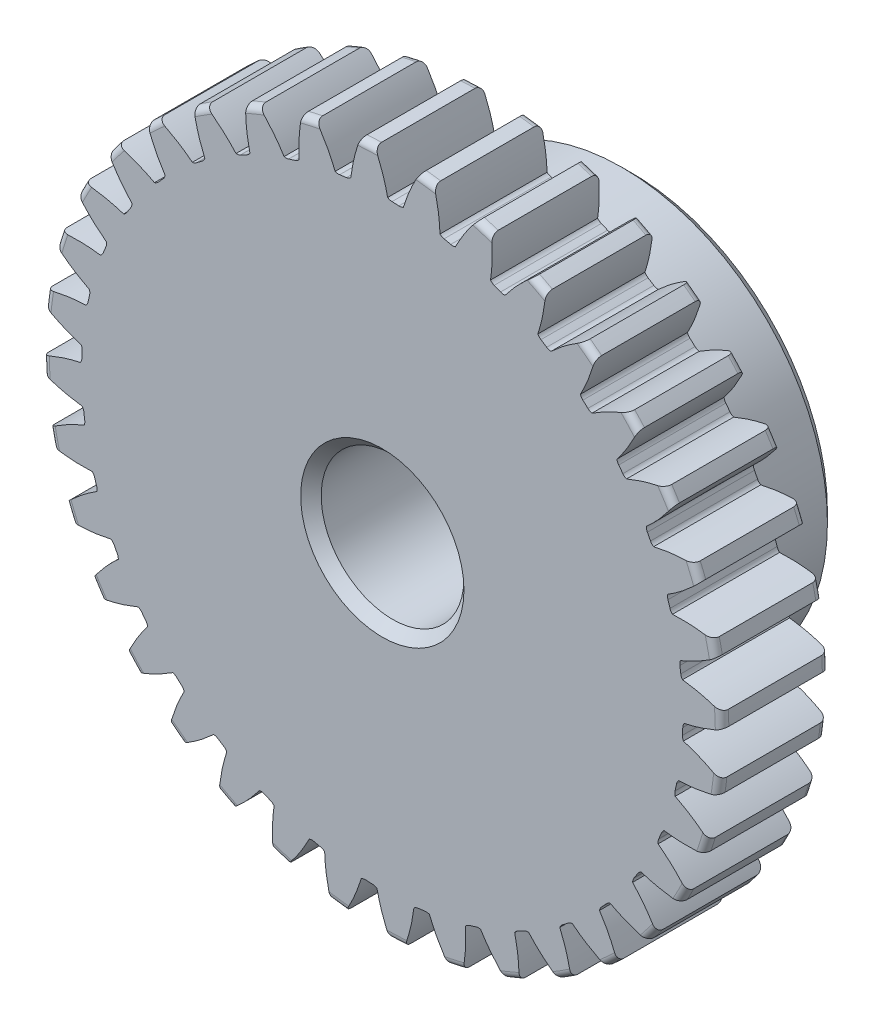
from build123d import *

# Parameters (mm, degrees)
SKETCH1_R           = 15.113
BOSS_EXTRUDE1_DEPTH = 4.7625
SKETCH2_W           = 6.3627
SKETCH2_H           = 9.128125
FILLET2_R           = 0.30226
CUT_EXTRUDE1_DEPTH  = 25.095136772
FILLET1_R           = 0.37404675
CIRPATTERN1_START   = -4.7625
CIRPATTERN1_DEPTH   = 4.7625
SKETCH5_R           = 3.175
CUT_EXTRUDE2_DEPTH  = 25.090372429
CHAMFER1_SIZE       = 0.45640625


# Read off the part's stored shape, not the designer's step: CirPattern1
with BuildPart() as part:
    # Sketch1 → Boss-Extrude1 (new body)
    with BuildSketch(Plane.XY):
        Circle(SKETCH1_R)
    extrude(amount=-BOSS_EXTRUDE1_DEPTH)

    # Sketch2 → Revolve1 (revolve)
    with BuildSketch(Plane(origin=(0, 0, 0), x_dir=(0, 0, -1), z_dir=(1, 0, 0)), mode=Mode.PRIVATE) as revolve1_sk:
        with Locations((7.94385, 4.5640625)):
            Rectangle(SKETCH2_W, SKETCH2_H)
    revolve(revolve1_sk.sketch.rotate(Axis((0, 0, -4.7625), (0, 0, -1)), 90), axis=Axis((0, 0, -4.7625), (0, 0, -1)))

    # Fillet2
    fillet2_edges = [part.edges().sort_by_distance(p)[0] for p in [
        (-15.113, 0, 0),
        (-15.113, 0, -4.7625),
        (-9.128125, 0, -4.7625),
    ]]
    fillet(fillet2_edges, radius=FILLET2_R)

    # Sketch4 → Cut-Extrude1 (cut, through all)
    with BuildSketch(Plane.XY):
        with BuildLine():
            Line((0.237176436, 13.423763219), (0.237176436, 13.367027258))
            ThreePointArc((0.237176436, 13.367027258), (0.583154678, 13.35640674), (0.928742002, 13.336832783))
            Line((0.928742002, 13.336832783), (0.933686879, 13.393352845))
            add(Edge.make_bspline(
                [(5.384958135, 18.216495788), (1.903470706, 16.574475468), (0.933686879, 13.393352845)],
                knots=[0, 0, 0, 1, 1, 1], degree=2))
            ThreePointArc((5.384958135, 18.216495788), (0.828584885, 18.977669509), (-3.776790724, 18.616507319))
            add(Edge.make_bspline(
                [(-3.776790724, 18.616507319), (-0.451663302, 16.67730308), (0.237176436, 13.423763219)],
                knots=[0, 0, 0, 1, 1, 1], degree=2))
        make_face()
    extrude(amount=-CUT_EXTRUDE1_DEPTH, mode=Mode.SUBTRACT)

    # Fillet1
    # the kernel refuses this fillet: 0.37404675 mm, written as the material it adds along each edge
    with BuildSketch(Plane(origin=(0.928742002, 13.336832783, 0), x_dir=(0.08715594602887619, 0.9961946803069225, 0), z_dir=(0, 0, -1))) as fillet1_piece_1:
        with BuildLine():
            CenterArc((0.369006284, -0.205908271), FILLET1_R, 146.599497408, 31.552947117)
            Line((-0.004846016, -0.193848877), (-0.012323062, -0.193607689))
            ThreePointArc((-0.012323062, -0.193607689), (-0.009550147, -0.096746268), (-0.007479758, 0.000132716))
            Line((-0.007479758, 0.000132716), (0, 0.007480935))
            ThreePointArc((0, 0.007480935), (0.02836798, 0.007480935), (0.050490554, 0.004118165))
            Line((0.050490554, 0.004118165), (0.056735961, 0))
        make_face()
    extrude(amount=4.7625)
    with BuildSketch(Plane(origin=(0.237176436, 13.367027258, 0), x_dir=(9.239634799397424e-12, 1.0, 0), z_dir=(0, 0, -1))) as fillet1_piece_2:
        with BuildLine():
            CenterArc((0.369006284, 0.205908271), FILLET1_R, 181.847555475, 31.552947117)
            Line((-0.004846016, 0.193848877), (-0.012323062, 0.193607689))
            ThreePointArc((-0.012323062, 0.193607689), (-0.009550147, 0.096746268), (-0.007479758, -0.000132716))
            Line((-0.007479758, -0.000132716), (0, -0.007480935))
            ThreePointArc((0, -0.007480935), (0.02836798, -0.007480935), (0.050490554, -0.004118165))
            Line((0.050490554, -0.004118165), (0.056735961, 0))
        make_face()
    extrude(amount=4.7625)

    # CirPattern1 outline → CirPattern1 (cut)
    with BuildSketch(Plane.XY.offset(CIRPATTERN1_START)):
        with BuildLine():
            ThreePointArc((-1.593973254, 13.273768103), (-1.4946809, 13.29988325), (-1.406229237, 13.352010745))
            add(Edge.make_bspline(
                [(-1.406229237, 13.352010745), (-1.295819924, 14.257210449), (-0.979335817, 15.08124007)],
                knots=[0, 0, 0, 0.274203611, 0.274203611, 0.274203611], degree=2))
            ThreePointArc((-0.979335817, 15.08124007), (-1.972640814, 14.983706391), (-2.957342519, 14.820826367))
            add(Edge.make_bspline(
                [(-2.957342519, 14.820826367), (-2.438368785, 14.106791157), (-2.097438827, 13.261011348)],
                knots=[0.725796389, 0.725796389, 0.725796389, 1, 1, 1], degree=2))
            ThreePointArc((-2.097438827, 13.261011348), (-1.998509498, 13.233553009), (-1.895841352, 13.234026445))
            ThreePointArc((-1.895841352, 13.234026445), (-1.745020443, 13.254756657), (-1.593973254, 13.273768103))
        make_face()
        with BuildLine():
            add(Edge.make_bspline(
                [(-3.70341779, 12.904974556), (-3.75187212, 13.815594618), (-3.58328736, 14.682062266)],
                knots=[0, 0, 0, 0.274203611, 0.274203611, 0.274203611], degree=2))
            ThreePointArc((-3.58328736, 14.682062266), (-4.544565277, 14.413524739), (-5.486023331, 14.082127573))
            add(Edge.make_bspline(
                [(-5.486023331, 14.082127573), (-4.850943061, 13.469059005), (-4.368324473, 12.695330359)],
                knots=[0.725796389, 0.725796389, 0.725796389, 1, 1, 1], degree=2))
            ThreePointArc((-4.368324473, 12.695330359), (-4.266130012, 12.68546807), (-4.165103837, 12.703762451))
            ThreePointArc((-4.165103837, 12.703762451), (-4.020174, 12.7503675), (-3.874722861, 12.795319188))
            ThreePointArc((-3.874722861, 12.795319188), (-3.781473829, 12.838279524), (-3.70341779, 12.904974556))
        make_face()
        with BuildLine():
            ThreePointArc((4.237812028, 14.506678401), (3.271053391, 14.754761222), (2.290028217, 14.938491884))
            add(Edge.make_bspline(
                [(2.290028217, 14.938491884), (2.533489579, 14.090018794), (2.564585214, 13.178640836)],
                knots=[0.725796389, 0.725796389, 0.725796389, 1, 1, 1], degree=2))
            ThreePointArc((2.564585214, 13.178640836), (2.648157068, 13.119002614), (2.744795493, 13.084332925))
            ThreePointArc((2.744795493, 13.084332925), (2.893610938, 13.052229163), (3.042051164, 13.018432897))
            ThreePointArc((3.042051164, 13.018432897), (3.144287363, 13.009013123), (3.245233391, 13.027744695))
            add(Edge.make_bspline(
                [(3.245233391, 13.027744695), (3.658580741, 13.840591968), (4.237812028, 14.506678401)],
                knots=[0, 0, 0, 0.274203611, 0.274203611, 0.274203611], degree=2))
        make_face()
        with BuildLine():
            add(Edge.make_bspline(
                [(-5.888079866, 12.065827245), (-6.093925581, 12.954198936), (-6.078362531, 13.836777429)],
                knots=[0, 0, 0, 0.274203611, 0.274203611, 0.274203611], degree=2))
            ThreePointArc((-6.078362531, 13.836777429), (-6.978405423, 13.405395432), (-7.8480141, 12.915550458))
            add(Edge.make_bspline(
                [(-7.8480141, 12.915550458), (-7.116123887, 12.422076311), (-6.50648079, 11.74390818)],
                knots=[0.725796389, 0.725796389, 0.725796389, 1, 1, 1], degree=2))
            ThreePointArc((-6.50648079, 11.74390818), (-6.404126325, 11.751941604), (-6.30781175, 11.787501063))
            ThreePointArc((-6.30781175, 11.787501063), (-6.173176605, 11.858564879), (-6.037740974, 11.928090975))
            ThreePointArc((-6.037740974, 11.928090975), (-5.953368588, 11.986591171), (-5.888079866, 12.065827245))
        make_face()
        with BuildLine():
            ThreePointArc((6.69248841, 13.550401024), (5.783496138, 13.962590786), (4.849279435, 14.3138834))
            add(Edge.make_bspline(
                [(4.849279435, 14.3138834), (4.941706267, 13.4360239), (4.814070367, 12.533092121)],
                knots=[0.725796389, 0.725796389, 0.725796389, 1, 1, 1], degree=2))
            ThreePointArc((4.814070367, 12.533092121), (4.886016509, 12.459847837), (4.97516645, 12.408923772))
            ThreePointArc((4.97516645, 12.408923772), (5.116146294, 12.351466207), (5.25646272, 12.292407008))
            ThreePointArc((5.25646272, 12.292407008), (5.355509995, 12.265377212), (5.45817513, 12.266295116))
            add(Edge.make_bspline(
                [(5.45817513, 12.266295116), (6.006392252, 12.995016398), (6.69248841, 13.550401024)],
                knots=[0, 0, 0, 0.274203611, 0.274203611, 0.274203611], degree=2))
        make_face()
        with BuildLine():
            add(Edge.make_bspline(
                [(-7.893835616, 10.860065878), (-8.250818197, 11.699196474), (-8.388749731, 12.571069112)],
                knots=[0, 0, 0, 0.274203611, 0.274203611, 0.274203611], degree=2))
            ThreePointArc((-8.388749731, 12.571069112), (-9.200210252, 11.989949969), (-9.971546931, 11.356540879))
            add(Edge.make_bspline(
                [(-9.971546931, 11.356540879), (-9.16508489, 10.997655115), (-8.446940981, 10.435653294)],
                knots=[0.725796389, 0.725796389, 0.725796389, 1, 1, 1], degree=2))
            ThreePointArc((-8.446940981, 10.435653294), (-8.347536499, 10.461338338), (-8.258859995, 10.51308242))
            ThreePointArc((-8.258859995, 10.51308242), (-8.138610362, 10.606445764), (-8.017305382, 10.698433754))
            ThreePointArc((-8.017305382, 10.698433754), (-7.944373255, 10.770696311), (-7.893835616, 10.860065878))
        make_face()
        with BuildLine():
            ThreePointArc((8.943816918, 12.182401569), (8.120210282, 12.746174093), (7.261187752, 13.254354811))
            add(Edge.make_bspline(
                [(7.261187752, 13.254354811), (7.19977171, 12.373782219), (6.917282428, 11.506731744)],
                knots=[0.725796389, 0.725796389, 0.725796389, 1, 1, 1], degree=2))
            ThreePointArc((6.917282428, 11.506731744), (6.97541681, 11.422106888), (7.054369492, 11.356475749))
            ThreePointArc((7.054369492, 11.356475749), (7.183230135, 11.275410201), (7.311159316, 11.192882552))
            ThreePointArc((7.311159316, 11.192882552), (7.404008166, 11.149064021), (7.505272979, 11.132140366))
            add(Edge.make_bspline(
                [(7.505272979, 11.132140366), (8.171702574, 11.75459383), (8.943816918, 12.182401569)],
                knots=[0, 0, 0, 0.274203611, 0.274203611, 0.274203611], degree=2))
        make_face()
        with BuildLine():
            add(Edge.make_bspline(
                [(-9.659741165, 9.324326906), (-10.157013877, 10.088719848), (-10.444249016, 10.923395222)],
                knots=[0, 0, 0, 0.274203611, 0.274203611, 0.274203611], degree=2))
            ThreePointArc((-10.444249016, 10.923395222), (-11.142471348, 10.210195943), (-11.792099355, 9.452468551))
            add(Edge.make_bspline(
                [(-11.792099355, 9.452468551), (-10.935569426, 9.239075733), (-10.130745145, 8.810316363)],
                knots=[0.725796389, 0.725796389, 0.725796389, 1, 1, 1], degree=2))
            ThreePointArc((-10.130745145, 8.810316363), (-10.037311002, 8.852872601), (-9.958966958, 8.919229087))
            ThreePointArc((-9.958966958, 8.919229087), (-9.856756562, 9.032055163), (-9.753268024, 9.143710036))
            ThreePointArc((-9.753268024, 9.143710036), (-9.693992161, 9.227539294), (-9.659741165, 9.324326906))
        make_face()
        with BuildLine():
            ThreePointArc((10.923392075, 10.444246007), (10.210195946, 11.142471351), (9.452468554, 11.792099359))
            add(Edge.make_bspline(
                [(9.452468554, 11.792099359), (9.239075733, 10.935569426), (8.810316363, 10.130745145)],
                knots=[0.725796389, 0.725796389, 0.725796389, 1, 1, 1], degree=2))
            ThreePointArc((8.810316363, 10.130745145), (8.852872601, 10.037311002), (8.919229087, 9.958966958))
            ThreePointArc((8.919229087, 9.958966958), (9.032055163, 9.856756562), (9.143710036, 9.753268024))
            ThreePointArc((9.143710036, 9.753268024), (9.227539294, 9.693992161), (9.324326906, 9.659741165))
            add(Edge.make_bspline(
                [(9.324326906, 9.659741165), (10.088719848, 10.157013877), (10.923392075, 10.444246007)],
                knots=[0, 0, 0, 0.274203611, 0.274203611, 0.274203611], degree=2))
        make_face()
        with BuildLine():
            add(Edge.make_bspline(
                [(-11.132140366, 7.505272979), (-11.75459383, 8.171702574), (-12.18240508, 8.943819495)],
                knots=[0, 0, 0, 0.274203611, 0.274203611, 0.274203611], degree=2))
            ThreePointArc((-12.18240508, 8.943819495), (-12.74617409, 8.12021028), (-13.254354808, 7.26118775))
            add(Edge.make_bspline(
                [(-13.254354808, 7.26118775), (-12.373782219, 7.19977171), (-11.506731744, 6.917282428)],
                knots=[0.725796389, 0.725796389, 0.725796389, 1, 1, 1], degree=2))
            ThreePointArc((-11.506731744, 6.917282428), (-11.422106888, 6.97541681), (-11.356475749, 7.054369492))
            ThreePointArc((-11.356475749, 7.054369492), (-11.275410201, 7.183230135), (-11.192882552, 7.311159316))
            ThreePointArc((-11.192882552, 7.311159316), (-11.149064021, 7.404008166), (-11.132140366, 7.505272979))
        make_face()
        with BuildLine():
            ThreePointArc((12.571065491, 8.388747314), (11.989949973, 9.200210255), (11.356540882, 9.971546934))
            add(Edge.make_bspline(
                [(11.356540882, 9.971546934), (10.997655115, 9.16508489), (10.435653294, 8.446940981)],
                knots=[0.725796389, 0.725796389, 0.725796389, 1, 1, 1], degree=2))
            ThreePointArc((10.435653294, 8.446940981), (10.461338338, 8.347536499), (10.51308242, 8.258859995))
            ThreePointArc((10.51308242, 8.258859995), (10.606445764, 8.138610362), (10.698433754, 8.017305382))
            ThreePointArc((10.698433754, 8.017305382), (10.770696311, 7.944373255), (10.860065878, 7.893835616))
            add(Edge.make_bspline(
                [(10.860065878, 7.893835616), (11.699196474, 8.250818197), (12.571065491, 8.388747314)],
                knots=[0, 0, 0, 0.274203611, 0.274203611, 0.274203611], degree=2))
        make_face()
        with BuildLine():
            add(Edge.make_bspline(
                [(-12.266295116, 5.45817513), (-12.995016398, 6.006392252), (-13.550404929, 6.692490339)],
                knots=[0, 0, 0, 0.274203611, 0.274203611, 0.274203611], degree=2))
            ThreePointArc((-13.550404929, 6.692490339), (-13.962590782, 5.783496137), (-14.313883396, 4.849279434))
            add(Edge.make_bspline(
                [(-14.313883396, 4.849279434), (-13.4360239, 4.941706267), (-12.533092121, 4.814070367)],
                knots=[0.725796389, 0.725796389, 0.725796389, 1, 1, 1], degree=2))
            ThreePointArc((-12.533092121, 4.814070367), (-12.459847837, 4.886016509), (-12.408923772, 4.97516645))
            ThreePointArc((-12.408923772, 4.97516645), (-12.351466207, 5.116146294), (-12.292407008, 5.25646272))
            ThreePointArc((-12.292407008, 5.25646272), (-12.265377212, 5.355509995), (-12.266295116, 5.45817513))
        make_face()
        with BuildLine():
            ThreePointArc((13.836773443, 6.07836078), (13.405395436, 6.978405425), (12.915550462, 7.848014102))
            add(Edge.make_bspline(
                [(12.915550462, 7.848014102), (12.422076311, 7.116123887), (11.74390818, 6.50648079)],
                knots=[0.725796389, 0.725796389, 0.725796389, 1, 1, 1], degree=2))
            ThreePointArc((11.74390818, 6.50648079), (11.751941604, 6.404126325), (11.787501063, 6.30781175))
            ThreePointArc((11.787501063, 6.30781175), (11.858564879, 6.173176605), (11.928090975, 6.037740974))
            ThreePointArc((11.928090975, 6.037740974), (11.986591171, 5.953368588), (12.065827245, 5.888079866))
            add(Edge.make_bspline(
                [(12.065827245, 5.888079866), (12.954198936, 6.093925581), (13.836773443, 6.07836078)],
                knots=[0, 0, 0, 0.274203611, 0.274203611, 0.274203611], degree=2))
        make_face()
        with BuildLine():
            add(Edge.make_bspline(
                [(-13.027744695, 3.245233391), (-13.840591968, 3.658580741), (-14.506682582, 4.23781325)],
                knots=[0, 0, 0, 0.274203611, 0.274203611, 0.274203611], degree=2))
            ThreePointArc((-14.506682582, 4.23781325), (-14.754761219, 3.27105339), (-14.938491881, 2.290028216))
            add(Edge.make_bspline(
                [(-14.938491881, 2.290028216), (-14.090018794, 2.533489579), (-13.178640836, 2.564585214)],
                knots=[0.725796389, 0.725796389, 0.725796389, 1, 1, 1], degree=2))
            ThreePointArc((-13.178640836, 2.564585214), (-13.119002614, 2.648157068), (-13.084332925, 2.744795493))
            ThreePointArc((-13.084332925, 2.744795493), (-13.052229163, 2.893610938), (-13.018432897, 3.042051164))
            ThreePointArc((-13.018432897, 3.042051164), (-13.009013123, 3.144287363), (-13.027744695, 3.245233391))
        make_face()
        with BuildLine():
            ThreePointArc((14.682058037, 3.583286328), (14.413524743, 4.544565278), (14.082127577, 5.486023332))
            add(Edge.make_bspline(
                [(14.082127577, 5.486023332), (13.469059005, 4.850943061), (12.695330359, 4.368324473)],
                knots=[0.725796389, 0.725796389, 0.725796389, 1, 1, 1], degree=2))
            ThreePointArc((12.695330359, 4.368324473), (12.68546807, 4.266130012), (12.703762451, 4.165103837))
            ThreePointArc((12.703762451, 4.165103837), (12.7503675, 4.020174), (12.795319188, 3.874722861))
            ThreePointArc((12.795319188, 3.874722861), (12.838279524, 3.781473829), (12.904974556, 3.70341779))
            add(Edge.make_bspline(
                [(12.904974556, 3.70341779), (13.815594618, 3.75187212), (14.682058037, 3.583286328)],
                knots=[0, 0, 0, 0.274203611, 0.274203611, 0.274203611], degree=2))
        make_face()
        with BuildLine():
            add(Edge.make_bspline(
                [(-13.393352845, 0.933686879), (-14.265628155, 1.199605106), (-15.022182026, 1.65437235)],
                knots=[0, 0, 0, 0.274203611, 0.274203611, 0.274203611], degree=2))
            ThreePointArc((-15.022182026, 1.65437235), (-15.098615702, 0.659221342), (-15.109201849, -0.33880435))
            add(Edge.make_bspline(
                [(-15.109201849, -0.33880435), (-14.315895597, 0.048294093), (-13.423763219, 0.237176436)],
                knots=[0.725796389, 0.725796389, 0.725796389, 1, 1, 1], degree=2))
            ThreePointArc((-13.423763219, 0.237176436), (-13.379543135, 0.329834715), (-13.362181243, 0.431025313))
            ThreePointArc((-13.362181243, 0.431025313), (-13.35640674, 0.583154677), (-13.34890029, 0.735208423))
            ThreePointArc((-13.34890029, 0.735208423), (-13.357376753, 0.837527151), (-13.393352845, 0.933686879))
        make_face()
        with BuildLine():
            ThreePointArc((15.081235726, 0.979335535), (14.983706395, 1.972640815), (14.820826371, 2.957342519))
            add(Edge.make_bspline(
                [(14.820826371, 2.957342519), (14.106791157, 2.438368785), (13.261011348, 2.097438827)],
                knots=[0.725796389, 0.725796389, 0.725796389, 1, 1, 1], degree=2))
            ThreePointArc((13.261011348, 2.097438827), (13.233553009, 1.998509498), (13.234026445, 1.895841352))
            ThreePointArc((13.234026445, 1.895841352), (13.254756657, 1.745020443), (13.273768103, 1.593973254))
            ThreePointArc((13.273768103, 1.593973254), (13.29988325, 1.4946809), (13.352010745, 1.406229237))
            add(Edge.make_bspline(
                [(13.352010745, 1.406229237), (14.257210449, 1.295819924), (15.081235726, 0.979335535)],
                knots=[0, 0, 0, 0.274203611, 0.274203611, 0.274203611], degree=2))
        make_face()
        with BuildLine():
            add(Edge.make_bspline(
                [(-13.352010745, -1.406229237), (-14.257210449, -1.295819924), (-15.08124007, -0.979335817)],
                knots=[0, 0, 0, 0.274203611, 0.274203611, 0.274203611], degree=2))
            ThreePointArc((-15.08124007, -0.979335817), (-14.983706388, -1.972640814), (-14.820826365, -2.957342518))
            add(Edge.make_bspline(
                [(-14.820826365, -2.957342518), (-14.106791157, -2.438368785), (-13.261011348, -2.097438827)],
                knots=[0.725796389, 0.725796389, 0.725796389, 1, 1, 1], degree=2))
            ThreePointArc((-13.261011348, -2.097438827), (-13.233553009, -1.998509498), (-13.234026445, -1.895841352))
            ThreePointArc((-13.234026445, -1.895841352), (-13.254756657, -1.745020443), (-13.273768103, -1.593973254))
            ThreePointArc((-13.273768103, -1.593973254), (-13.29988325, -1.4946809), (-13.352010745, -1.406229237))
        make_face()
        with BuildLine():
            ThreePointArc((15.022177699, -1.654371873), (15.098615709, -0.659221342), (15.109201856, 0.33880435))
            add(Edge.make_bspline(
                [(15.109201856, 0.33880435), (14.315895597, -0.048294093), (13.423763219, -0.237176436)],
                knots=[0.725796389, 0.725796389, 0.725796389, 1, 1, 1], degree=2))
            ThreePointArc((13.423763219, -0.237176436), (13.379543135, -0.329834715), (13.362181243, -0.431025313))
            ThreePointArc((13.362181243, -0.431025313), (13.35640674, -0.583154677), (13.34890029, -0.735208423))
            ThreePointArc((13.34890029, -0.735208423), (13.357376753, -0.837527151), (13.393352845, -0.933686879))
            add(Edge.make_bspline(
                [(13.393352845, -0.933686879), (14.265628155, -1.199605106), (15.022177699, -1.654371873)],
                knots=[0, 0, 0, 0.274203611, 0.274203611, 0.274203611], degree=2))
        make_face()
        with BuildLine():
            add(Edge.make_bspline(
                [(-12.904974556, -3.70341779), (-13.815594618, -3.75187212), (-14.682062266, -3.58328736)],
                knots=[0, 0, 0, 0.274203611, 0.274203611, 0.274203611], degree=2))
            ThreePointArc((-14.682062266, -3.58328736), (-14.413524738, -4.544565276), (-14.082127572, -5.48602333))
            add(Edge.make_bspline(
                [(-14.082127572, -5.48602333), (-13.469059005, -4.850943061), (-12.695330359, -4.368324473)],
                knots=[0.725796389, 0.725796389, 0.725796389, 1, 1, 1], degree=2))
            ThreePointArc((-12.695330359, -4.368324473), (-12.68546807, -4.266130012), (-12.703762451, -4.165103837))
            ThreePointArc((-12.703762451, -4.165103837), (-12.7503675, -4.020174), (-12.795319188, -3.874722861))
            ThreePointArc((-12.795319188, -3.874722861), (-12.838279524, -3.781473829), (-12.904974556, -3.70341779))
        make_face()
        with BuildLine():
            ThreePointArc((14.506678404, -4.237812029), (14.754761225, -3.271053392), (14.938491887, -2.290028217))
            add(Edge.make_bspline(
                [(14.938491887, -2.290028217), (14.090018794, -2.533489579), (13.178640836, -2.564585214)],
                knots=[0.725796389, 0.725796389, 0.725796389, 1, 1, 1], degree=2))
            ThreePointArc((13.178640836, -2.564585214), (13.119002614, -2.648157068), (13.084332925, -2.744795493))
            ThreePointArc((13.084332925, -2.744795493), (13.052229163, -2.893610938), (13.018432897, -3.042051164))
            ThreePointArc((13.018432897, -3.042051164), (13.009013123, -3.144287363), (13.027744695, -3.245233391))
            add(Edge.make_bspline(
                [(13.027744695, -3.245233391), (13.840591968, -3.658580741), (14.506678404, -4.237812029)],
                knots=[0, 0, 0, 0.274203611, 0.274203611, 0.274203611], degree=2))
        make_face()
        with BuildLine():
            add(Edge.make_bspline(
                [(-12.065827245, -5.888079866), (-12.954198936, -6.093925581), (-13.836777429, -6.078362531)],
                knots=[0, 0, 0, 0.274203611, 0.274203611, 0.274203611], degree=2))
            ThreePointArc((-13.836777429, -6.078362531), (-13.405395432, -6.978405423), (-12.915550458, -7.848014099))
            add(Edge.make_bspline(
                [(-12.915550458, -7.848014099), (-12.422076311, -7.116123887), (-11.74390818, -6.50648079)],
                knots=[0.725796389, 0.725796389, 0.725796389, 1, 1, 1], degree=2))
            ThreePointArc((-11.74390818, -6.50648079), (-11.751941604, -6.404126325), (-11.787501063, -6.30781175))
            ThreePointArc((-11.787501063, -6.30781175), (-11.858564879, -6.173176605), (-11.928090975, -6.037740974))
            ThreePointArc((-11.928090975, -6.037740974), (-11.986591171, -5.953368588), (-12.065827245, -5.888079866))
        make_face()
        with BuildLine():
            ThreePointArc((13.550401026, -6.692488411), (13.962590788, -5.783496139), (14.313883402, -4.849279436))
            add(Edge.make_bspline(
                [(14.313883402, -4.849279436), (13.4360239, -4.941706267), (12.533092121, -4.814070367)],
                knots=[0.725796389, 0.725796389, 0.725796389, 1, 1, 1], degree=2))
            ThreePointArc((12.533092121, -4.814070367), (12.459847837, -4.886016509), (12.408923772, -4.97516645))
            ThreePointArc((12.408923772, -4.97516645), (12.351466207, -5.116146294), (12.292407008, -5.25646272))
            ThreePointArc((12.292407008, -5.25646272), (12.265377212, -5.355509995), (12.266295116, -5.45817513))
            add(Edge.make_bspline(
                [(12.266295116, -5.45817513), (12.995016398, -6.006392252), (13.550401026, -6.692488411)],
                knots=[0, 0, 0, 0.274203611, 0.274203611, 0.274203611], degree=2))
        make_face()
        with BuildLine():
            add(Edge.make_bspline(
                [(-10.860065878, -7.893835616), (-11.699196474, -8.250818197), (-12.571069112, -8.388749731)],
                knots=[0, 0, 0, 0.274203611, 0.274203611, 0.274203611], degree=2))
            ThreePointArc((-12.571069112, -8.388749731), (-11.989949969, -9.200210252), (-11.356540879, -9.971546932))
            add(Edge.make_bspline(
                [(-11.356540879, -9.971546932), (-10.997655115, -9.16508489), (-10.435653294, -8.446940981)],
                knots=[0.725796389, 0.725796389, 0.725796389, 1, 1, 1], degree=2))
            ThreePointArc((-10.435653294, -8.446940981), (-10.461338338, -8.347536499), (-10.51308242, -8.258859995))
            ThreePointArc((-10.51308242, -8.258859995), (-10.606445764, -8.138610362), (-10.698433754, -8.017305382))
            ThreePointArc((-10.698433754, -8.017305382), (-10.770696311, -7.944373255), (-10.860065878, -7.893835616))
        make_face()
        with BuildLine():
            ThreePointArc((12.18240157, -8.943816919), (12.746174095, -8.120210283), (13.254354813, -7.261187753))
            add(Edge.make_bspline(
                [(13.254354813, -7.261187753), (12.373782219, -7.19977171), (11.506731744, -6.917282428)],
                knots=[0.725796389, 0.725796389, 0.725796389, 1, 1, 1], degree=2))
            ThreePointArc((11.506731744, -6.917282428), (11.422106888, -6.97541681), (11.356475749, -7.054369492))
            ThreePointArc((11.356475749, -7.054369492), (11.275410201, -7.183230135), (11.192882552, -7.311159316))
            ThreePointArc((11.192882552, -7.311159316), (11.149064021, -7.404008166), (11.132140366, -7.505272979))
            add(Edge.make_bspline(
                [(11.132140366, -7.505272979), (11.75459383, -8.171702574), (12.18240157, -8.943816919)],
                knots=[0, 0, 0, 0.274203611, 0.274203611, 0.274203611], degree=2))
        make_face()
        with BuildLine():
            add(Edge.make_bspline(
                [(-9.324326906, -9.659741165), (-10.088719848, -10.157013877), (-10.923395222, -10.444249016)],
                knots=[0, 0, 0, 0.274203611, 0.274203611, 0.274203611], degree=2))
            ThreePointArc((-10.923395222, -10.444249016), (-10.210195943, -11.142471348), (-9.452468552, -11.792099356))
            add(Edge.make_bspline(
                [(-9.452468552, -11.792099356), (-9.239075733, -10.935569426), (-8.810316363, -10.130745145)],
                knots=[0.725796389, 0.725796389, 0.725796389, 1, 1, 1], degree=2))
            ThreePointArc((-8.810316363, -10.130745145), (-8.852872601, -10.037311002), (-8.919229087, -9.958966958))
            ThreePointArc((-8.919229087, -9.958966958), (-9.032055163, -9.856756562), (-9.143710036, -9.753268024))
            ThreePointArc((-9.143710036, -9.753268024), (-9.227539294, -9.693992161), (-9.324326906, -9.659741165))
        make_face()
        with BuildLine():
            ThreePointArc((10.444246007, -10.923392075), (11.142471352, -10.210195947), (11.79209936, -9.452468555))
            add(Edge.make_bspline(
                [(11.79209936, -9.452468555), (10.935569426, -9.239075733), (10.130745145, -8.810316363)],
                knots=[0.725796389, 0.725796389, 0.725796389, 1, 1, 1], degree=2))
            ThreePointArc((10.130745145, -8.810316363), (10.037311002, -8.852872601), (9.958966958, -8.919229087))
            ThreePointArc((9.958966958, -8.919229087), (9.856756562, -9.032055163), (9.753268024, -9.143710036))
            ThreePointArc((9.753268024, -9.143710036), (9.693992161, -9.227539294), (9.659741165, -9.324326906))
            add(Edge.make_bspline(
                [(9.659741165, -9.324326906), (10.157013877, -10.088719848), (10.444246007, -10.923392075)],
                knots=[0, 0, 0, 0.274203611, 0.274203611, 0.274203611], degree=2))
        make_face()
        with BuildLine():
            add(Edge.make_bspline(
                [(-7.505272979, -11.132140366), (-8.171702574, -11.75459383), (-8.943819495, -12.18240508)],
                knots=[0, 0, 0, 0.274203611, 0.274203611, 0.274203611], degree=2))
            ThreePointArc((-8.943819495, -12.18240508), (-8.120210281, -12.746174091), (-7.261187751, -13.254354809))
            add(Edge.make_bspline(
                [(-7.261187751, -13.254354809), (-7.19977171, -12.373782219), (-6.917282428, -11.506731744)],
                knots=[0.725796389, 0.725796389, 0.725796389, 1, 1, 1], degree=2))
            ThreePointArc((-6.917282428, -11.506731744), (-6.97541681, -11.422106888), (-7.054369492, -11.356475749))
            ThreePointArc((-7.054369492, -11.356475749), (-7.183230135, -11.275410201), (-7.311159316, -11.192882552))
            ThreePointArc((-7.311159316, -11.192882552), (-7.404008166, -11.149064021), (-7.505272979, -11.132140366))
        make_face()
        with BuildLine():
            ThreePointArc((8.388747314, -12.571065491), (9.200210255, -11.989949973), (9.971546935, -11.356540882))
            add(Edge.make_bspline(
                [(9.971546935, -11.356540882), (9.16508489, -10.997655115), (8.446940981, -10.435653294)],
                knots=[0.725796389, 0.725796389, 0.725796389, 1, 1, 1], degree=2))
            ThreePointArc((8.446940981, -10.435653294), (8.347536499, -10.461338338), (8.258859995, -10.51308242))
            ThreePointArc((8.258859995, -10.51308242), (8.138610362, -10.606445764), (8.017305382, -10.698433754))
            ThreePointArc((8.017305382, -10.698433754), (7.944373255, -10.770696311), (7.893835616, -10.860065878))
            add(Edge.make_bspline(
                [(7.893835616, -10.860065878), (8.250818197, -11.699196474), (8.388747314, -12.571065491)],
                knots=[0, 0, 0, 0.274203611, 0.274203611, 0.274203611], degree=2))
        make_face()
        with BuildLine():
            add(Edge.make_bspline(
                [(-5.45817513, -12.266295116), (-6.006392252, -12.995016398), (-6.692490339, -13.550404929)],
                knots=[0, 0, 0, 0.274203611, 0.274203611, 0.274203611], degree=2))
            ThreePointArc((-6.692490339, -13.550404929), (-5.783496138, -13.962590784), (-4.849279435, -14.313883399))
            add(Edge.make_bspline(
                [(-4.849279435, -14.313883399), (-4.941706267, -13.4360239), (-4.814070367, -12.533092121)],
                knots=[0.725796389, 0.725796389, 0.725796389, 1, 1, 1], degree=2))
            ThreePointArc((-4.814070367, -12.533092121), (-4.886016509, -12.459847837), (-4.97516645, -12.408923772))
            ThreePointArc((-4.97516645, -12.408923772), (-5.116146294, -12.351466207), (-5.25646272, -12.292407008))
            ThreePointArc((-5.25646272, -12.292407008), (-5.355509995, -12.265377212), (-5.45817513, -12.266295116))
        make_face()
        with BuildLine():
            ThreePointArc((6.078360779, -13.836773442), (6.978405425, -13.405395436), (7.848014102, -12.915550462))
            add(Edge.make_bspline(
                [(7.848014102, -12.915550462), (7.116123887, -12.422076311), (6.50648079, -11.74390818)],
                knots=[0.725796389, 0.725796389, 0.725796389, 1, 1, 1], degree=2))
            ThreePointArc((6.50648079, -11.74390818), (6.404126325, -11.751941604), (6.30781175, -11.787501063))
            ThreePointArc((6.30781175, -11.787501063), (6.173176605, -11.858564879), (6.037740974, -11.928090975))
            ThreePointArc((6.037740974, -11.928090975), (5.953368588, -11.986591171), (5.888079866, -12.065827245))
            add(Edge.make_bspline(
                [(5.888079866, -12.065827245), (6.093925581, -12.954198936), (6.078360779, -13.836773442)],
                knots=[0, 0, 0, 0.274203611, 0.274203611, 0.274203611], degree=2))
        make_face()
        with BuildLine():
            add(Edge.make_bspline(
                [(-3.245233391, -13.027744695), (-3.658580741, -13.840591968), (-4.23781325, -14.506682582)],
                knots=[0, 0, 0, 0.274203611, 0.274203611, 0.274203611], degree=2))
            ThreePointArc((-4.23781325, -14.506682582), (-3.271053391, -14.754761222), (-2.290028217, -14.938491884))
            add(Edge.make_bspline(
                [(-2.290028217, -14.938491884), (-2.533489579, -14.090018794), (-2.564585214, -13.178640836)],
                knots=[0.725796389, 0.725796389, 0.725796389, 1, 1, 1], degree=2))
            ThreePointArc((-2.564585214, -13.178640836), (-2.648157068, -13.119002614), (-2.744795493, -13.084332925))
            ThreePointArc((-2.744795493, -13.084332925), (-2.893610938, -13.052229163), (-3.042051164, -13.018432897))
            ThreePointArc((-3.042051164, -13.018432897), (-3.144287363, -13.009013123), (-3.245233391, -13.027744695))
        make_face()
        with BuildLine():
            ThreePointArc((3.583286328, -14.682058035), (4.544565278, -14.413524742), (5.486023332, -14.082127576))
            add(Edge.make_bspline(
                [(5.486023332, -14.082127576), (4.850943061, -13.469059005), (4.368324473, -12.695330359)],
                knots=[0.725796389, 0.725796389, 0.725796389, 1, 1, 1], degree=2))
            ThreePointArc((4.368324473, -12.695330359), (4.266130012, -12.68546807), (4.165103837, -12.703762451))
            ThreePointArc((4.165103837, -12.703762451), (4.020174, -12.7503675), (3.874722861, -12.795319188))
            ThreePointArc((3.874722861, -12.795319188), (3.781473829, -12.838279524), (3.70341779, -12.904974556))
            add(Edge.make_bspline(
                [(3.70341779, -12.904974556), (3.75187212, -13.815594618), (3.583286328, -14.682058035)],
                knots=[0, 0, 0, 0.274203611, 0.274203611, 0.274203611], degree=2))
        make_face()
        with BuildLine():
            add(Edge.make_bspline(
                [(-0.933686879, -13.393352845), (-1.199605106, -14.265628155), (-1.65437235, -15.022182026)],
                knots=[0, 0, 0, 0.274203611, 0.274203611, 0.274203611], degree=2))
            ThreePointArc((-1.65437235, -15.022182026), (-0.659221342, -15.098615706), (0.33880435, -15.109201853))
            add(Edge.make_bspline(
                [(0.33880435, -15.109201853), (-0.048294093, -14.315895597), (-0.237176436, -13.423763219)],
                knots=[0.725796389, 0.725796389, 0.725796389, 1, 1, 1], degree=2))
            ThreePointArc((-0.237176436, -13.423763219), (-0.329834715, -13.379543135), (-0.431025313, -13.362181243))
            ThreePointArc((-0.431025313, -13.362181243), (-0.583154677, -13.35640674), (-0.735208423, -13.34890029))
            ThreePointArc((-0.735208423, -13.34890029), (-0.837527151, -13.357376753), (-0.933686879, -13.393352845))
        make_face()
        with BuildLine():
            ThreePointArc((0.979335535, -15.081235723), (1.972640814, -14.983706392), (2.957342519, -14.820826369))
            add(Edge.make_bspline(
                [(2.957342519, -14.820826369), (2.438368785, -14.106791157), (2.097438827, -13.261011348)],
                knots=[0.725796389, 0.725796389, 0.725796389, 1, 1, 1], degree=2))
            ThreePointArc((2.097438827, -13.261011348), (1.998509498, -13.233553009), (1.895841352, -13.234026445))
            ThreePointArc((1.895841352, -13.234026445), (1.745020443, -13.254756657), (1.593973254, -13.273768103))
            ThreePointArc((1.593973254, -13.273768103), (1.4946809, -13.29988325), (1.406229237, -13.352010745))
            add(Edge.make_bspline(
                [(1.406229237, -13.352010745), (1.295819924, -14.257210449), (0.979335535, -15.081235723)],
                knots=[0, 0, 0, 0.274203611, 0.274203611, 0.274203611], degree=2))
        make_face()
    extrude(amount=CIRPATTERN1_DEPTH, mode=Mode.SUBTRACT)

    # Sketch5 → Cut-Extrude2 (cut, through all)
    with BuildSketch(Plane.XY):
        Circle(SKETCH5_R)
    extrude(amount=-CUT_EXTRUDE2_DEPTH, mode=Mode.SUBTRACT)

    # Chamfer1
    chamfer1_edges = [part.edges().sort_by_distance(p)[0] for p in [
        (-3.175, 0, -11.1252),
        (-3.175, 0, 0),
        (-9.128125, 0, -11.1252),
    ]]
    chamfer(chamfer1_edges, length=CHAMFER1_SIZE)


solid = part.part
